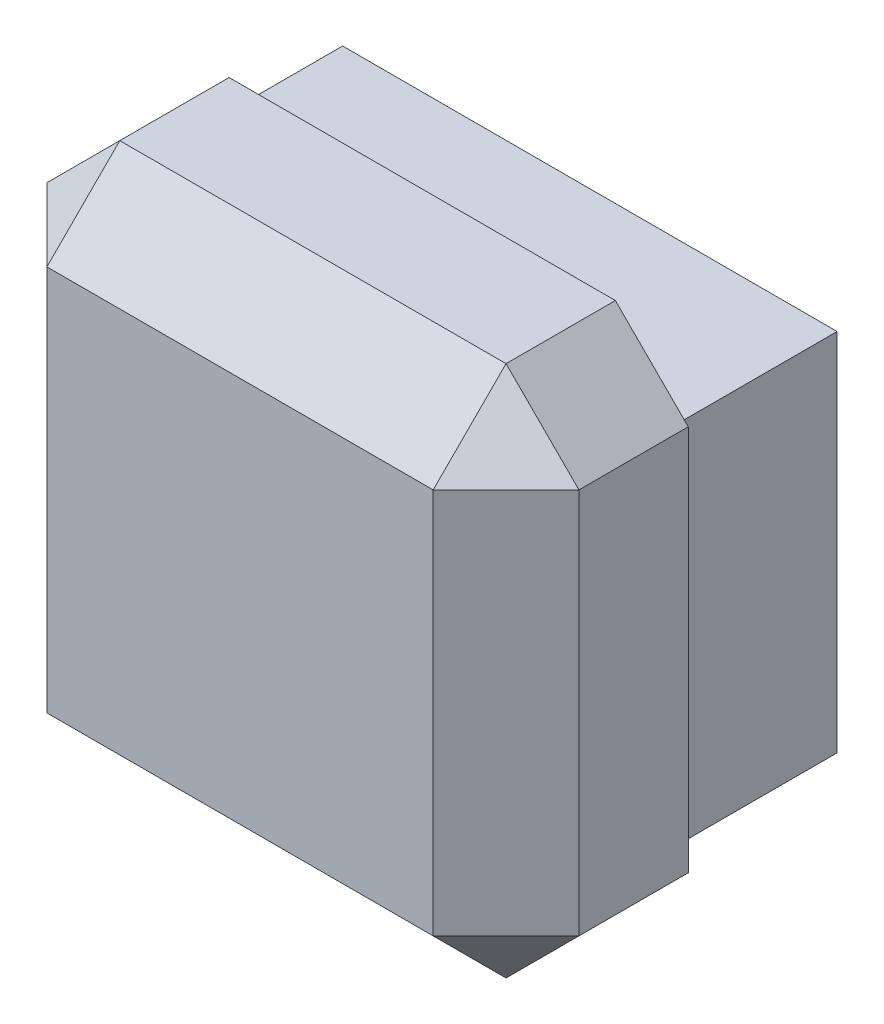
from build123d import *

# Parameters (mm, degrees)
SKETCH1_W           = 6.7846
SKETCH1_H           = 5.0066
SKETCH1_W_2         = 3.8846
SKETCH1_H_2         = 2.1066
BOSS_EXTRUDE1_DEPTH = 2.3
SKETCH2_W           = 7.3
SKETCH2_H           = 7.3
BOSS_EXTRUDE2_DEPTH = 2.5
CHAMFER1_SIZE       = 1
SKETCH3_W           = 3.8846
SKETCH3_H           = 2.1066
CUT_EXTRUDE1_DEPTH  = 1.1


with BuildPart() as part:
    # Sketch1 → Boss-Extrude1 (new body)
    with BuildSketch(Plane.XY):
        Rectangle(SKETCH1_W, SKETCH1_H)
        Rectangle(SKETCH1_W_2, SKETCH1_H_2, mode=Mode.SUBTRACT)
    extrude(amount=-BOSS_EXTRUDE1_DEPTH)

    # Sketch2 → Boss-Extrude2 (add)
    with BuildSketch(Plane.XY):
        Rectangle(SKETCH2_W, SKETCH2_H)
    extrude(amount=BOSS_EXTRUDE2_DEPTH)

    # Chamfer1
    chamfer1_edges = [part.edges().sort_by_distance(p)[0] for p in [
        (0, -3.65, 2.5),
        (3.65, -3.65, 1.25),
        (3.65, 0, 2.5),
        (3.65, 3.65, 1.25),
        (0, 3.65, 2.5),
        (-3.65, 3.65, 1.25),
        (-3.65, 0, 2.5),
        (-3.65, -3.65, 1.25),
    ]]
    chamfer(chamfer1_edges, length=CHAMFER1_SIZE)

    # Sketch3 → Cut-Extrude1 (cut)
    with BuildSketch(Plane(origin=(0, 0, 0), x_dir=(-1, 0, 0), z_dir=(0, 0, -1))):
        Rectangle(SKETCH3_W, SKETCH3_H)
    extrude(amount=-CUT_EXTRUDE1_DEPTH, mode=Mode.SUBTRACT)


solid = part.part
